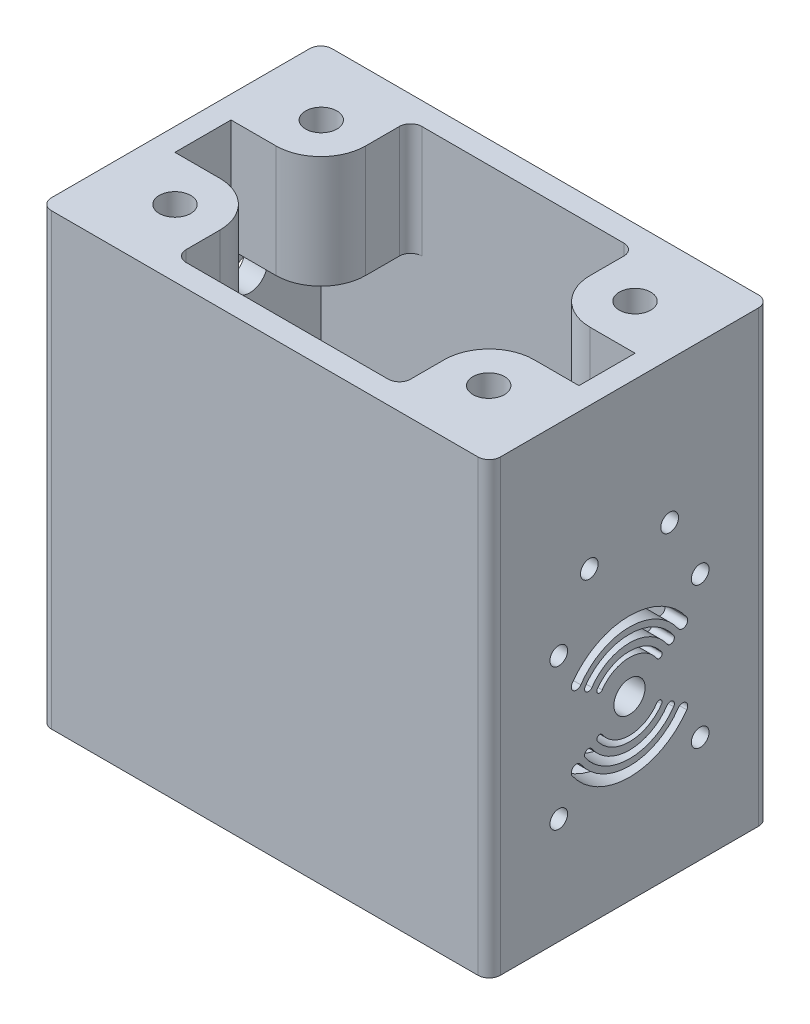
from build123d import *
from OCP.BRepAlgoAPI import BRepAlgoAPI_Cut
from OCP.TopTools import TopTools_ListOfShape

# Parameters (mm, degrees)
CUT_EXTRUDE1_DEPTH         = 101.6
CUT_EXTRUDE1_2_OUTLINE_W   = 25.4
CUT_EXTRUDE1_2_OUTLINE_H   = 20.32
CUT_EXTRUDE1_2_DEPTH       = 27.94
CUT_EXTRUDE1_START         = 73.66
CUT_EXTRUDE1_3_OUTLINE_W   = 25.4
CUT_EXTRUDE1_3_OUTLINE_H   = 20.32
CUT_EXTRUDE1_3_DEPTH       = 27.94
CUT_EXTRUDE1_4_OUTLINE_R   = 1.045
CUT_EXTRUDE1_4_OUTLINE_R_2 = 3.535106702
CUT_EXTRUDE1_4_DEPTH       = 5.08
CUT_EXTRUDE1_START_2       = 96.52
CUT_EXTRUDE1_5_OUTLINE_R   = 1.515
CUT_EXTRUDE1_5_OUTLINE_R_2 = 3.535106702
CUT_EXTRUDE1_5_DEPTH       = 5.08
CUT_EXTRUDE1_START_3       = 86.52
CUT_EXTRUDE1_6_DEPTH       = 10
CUT_EXTRUDE1_START_4       = 76.2
CUT_EXTRUDE1_7_OUTLINE_R   = 2.413
CUT_EXTRUDE1_7_OUTLINE_R_2 = 3.556
CUT_EXTRUDE1_7_DEPTH       = 25.4
CUT_EXTRUDE1_8_OUTLINE_R   = 3.556
CUT_EXTRUDE1_8_DEPTH       = 5.461
CUT_EXTRUDE1_START_5       = -1
CUT_EXTRUDE1_9_DEPTH       = 77.2
CUT_EXTRUDE1_START_6       = 12.4130001
CUT_EXTRUDE1_10_DEPTH      = 2.6669999
CUT_EXTRUDE1_START_7       = 5.280658157
CUT_EXTRUDE1_11_DEPTH      = 2.306341743
CUT_EXTRUDE1_START_8       = 7.5869999
CUT_EXTRUDE1_12_DEPTH      = 4.8260002
CUT_EXTRUDE1_START_9       = 82.1
CUT_EXTRUDE1_13_OUTLINE_R  = 2.413
CUT_EXTRUDE1_13_DEPTH      = 2.95
CUT_EXTRUDE1_14_DEPTH      = 2.6669999
CUT_EXTRUDE1_15_DEPTH      = 2.306341743
CUT_EXTRUDE1_16_DEPTH      = 4.8260002
CUT_EXTRUDE1_START_10      = 78.15
CUT_EXTRUDE1_17_OUTLINE_R  = 2.413
CUT_EXTRUDE1_17_DEPTH      = 2.95
SKETCH2_W                  = 9.799341843
SKETCH2_H                  = 12.300000782
CUT_EXTRUDE2_DEPTH         = 12
SKETCH3_W                  = 10
SKETCH3_H                  = 12.3
CUT_EXTRUDE3_DEPTH         = 12
BOSS_EXTRUDE1_START        = -5.079999
SKETCH6_R                  = 1.515
BOSS_EXTRUDE1_DEPTH        = 5.079999
BOSS_EXTRUDE2_START        = -5.08
SKETCH7_R                  = 1.045
BOSS_EXTRUDE2_DEPTH        = 5.08
SKETCH8_R                  = 2
CUT_EXTRUDE4_DEPTH         = 10
SKETCH9_R                  = 4
CUT_EXTRUDE5_DEPTH         = 10
SKETCH12_R                 = 2
CUT_EXTRUDE6_DEPTH         = 10


with BuildPart() as part:
    # Cut-Extrude1: read off the stored shape, not the designer's step
    # Cut-Extrude1 outline → Cut-Extrude1 (new body)
    with BuildSketch(Plane.YZ):
        Polygon((5.08, 58.42), (101.6, 58.42), (101.6, 63.5), (0, 63.5), (0, 0), (101.6, 0), (101.6, 5.08), (5.08, 5.08), align=None)
    extrude(amount=CUT_EXTRUDE1_DEPTH)


with BuildPart() as cut_extrude1_2_tool:
    # Cut-Extrude1 2 outline → Cut-Extrude1 2 (new body)
    with BuildSketch(Plane.YZ):
        with Locations((88.9, 48.26)):
            Rectangle(CUT_EXTRUDE1_2_OUTLINE_W, CUT_EXTRUDE1_2_OUTLINE_H)
        Polygon((101.6, 5.08), (101.6, 25.400000381), (76.2, 25.4), (76.2, 5.08), align=None)
    extrude(amount=CUT_EXTRUDE1_2_DEPTH)


with BuildPart() as part_1:
    add(part.part)


with BuildPart() as part_2:
    # Cut-Extrude1 2: joined with cut_extrude1_2_tool
    add(part_1.part.fuse(cut_extrude1_2_tool.part, tol=0.00001))


with BuildPart() as cut_extrude1_3_tool:
    # Cut-Extrude1 3 outline → Cut-Extrude1 3 (new body)
    with BuildSketch(Plane.YZ.offset(CUT_EXTRUDE1_START)):
        with Locations((88.9, 48.26)):
            Rectangle(CUT_EXTRUDE1_3_OUTLINE_W, CUT_EXTRUDE1_3_OUTLINE_H)
        Polygon((101.6, 5.08), (101.6, 25.400000381), (76.2, 25.4), (76.2, 5.08), align=None)
    extrude(amount=CUT_EXTRUDE1_3_DEPTH)


with BuildPart() as part_3:
    add(part_2.part)


with BuildPart() as part_4:
    # Cut-Extrude1 3: joined with cut_extrude1_3_tool
    add(part_3.part.fuse(cut_extrude1_3_tool.part, tol=0.00001))


with BuildPart() as cut_extrude1_4_tool:
    # Cut-Extrude1 4 outline → Cut-Extrude1 4 (new body)
    with BuildSketch(Plane.YZ):
        Polygon((76.2, 38.1), (76.2, 58.42), (5.08, 58.42), (5.08, 5.08), (76.2, 5.08), (76.2, 25.400000678), (101.6, 25.4), (101.6, 38.1), align=None)
        with Locations((81.6, 36.100000057)):
            Circle(CUT_EXTRUDE1_4_OUTLINE_R, mode=Mode.SUBTRACT)
        with Locations((81.6, 27.399999275)):
            Circle(CUT_EXTRUDE1_4_OUTLINE_R, mode=Mode.SUBTRACT)
        with BuildLine():
            ThreePointArc((46.057737105, 23.249999873), (50.557737172, 31.75), (46.057737105, 40.250000127))
            ThreePointArc((46.057737105, 40.250000127), (45.78975406, 41.51198884), (47.05773712, 41.750000149))
            ThreePointArc((47.05773712, 41.750000149), (52.258136816, 31.75), (47.05773712, 21.749999851))
            ThreePointArc((47.05773712, 21.749999851), (45.78975406, 21.98801116), (46.057737105, 23.249999873))
        make_face(mode=Mode.SUBTRACT)
        with BuildLine():
            ThreePointArc((49.134013144, 18.789999807), (47.490707098, 19.098462464), (47.838013125, 20.733999836))
            ThreePointArc((47.838013125, 20.733999836), (53.670013212, 31.75), (47.838013125, 42.766000164))
            ThreePointArc((47.838013125, 42.766000164), (47.490707098, 44.401537536), (49.134013144, 44.710000193))
            ThreePointArc((49.134013144, 44.710000193), (55.87373115, 31.75), (49.134013144, 18.789999807))
        make_face(mode=Mode.SUBTRACT)
        with BuildLine():
            ThreePointArc((32.248569061, 20.733999836), (32.595875088, 19.098462464), (30.952569042, 18.789999807))
            ThreePointArc((30.952569042, 18.789999807), (24.212851035, 31.75), (30.952569042, 44.710000193))
            ThreePointArc((30.952569042, 44.710000193), (32.595875088, 44.401537536), (32.248569061, 42.766000164))
            ThreePointArc((32.248569061, 42.766000164), (26.416568974, 31.75), (32.248569061, 20.733999836))
        make_face(mode=Mode.SUBTRACT)
        with BuildLine():
            ThreePointArc((34.028845081, 23.249999873), (34.296828126, 21.98801116), (33.028845066, 21.749999851))
            ThreePointArc((33.028845066, 21.749999851), (27.828445369, 31.75), (33.028845066, 41.750000149))
            ThreePointArc((33.028845066, 41.750000149), (34.296828126, 41.51198884), (34.028845081, 40.250000127))
            ThreePointArc((34.028845081, 40.250000127), (29.528845014, 31.75), (34.028845081, 23.249999873))
        make_face(mode=Mode.SUBTRACT)
        with BuildLine():
            ThreePointArc((35.666722358, 25.570008615), (35.86163475, 24.652125026), (34.939391286, 24.479012008))
            ThreePointArc((34.939391286, 24.479012008), (31.156979061, 31.752322721), (34.939391286, 39.025633433))
            ThreePointArc((34.939391286, 39.025633433), (35.86163475, 38.852520415), (35.666722358, 37.934636826))
            ThreePointArc((35.666722358, 37.934636826), (32.393732537, 31.752322721), (35.666722358, 25.570008615))
        make_face(mode=Mode.SUBTRACT)
        with Locations((40.043291093, 31.75)):
            Circle(CUT_EXTRUDE1_4_OUTLINE_R_2, mode=Mode.SUBTRACT)
        with BuildLine():
            ThreePointArc((44.41570915, 25.570008615), (47.68869897, 31.752322721), (44.41570915, 37.934636826))
            ThreePointArc((44.41570915, 37.934636826), (44.220796757, 38.852520415), (45.143040221, 39.025633433))
            ThreePointArc((45.143040221, 39.025633433), (48.925452447, 31.752322721), (45.143040221, 24.479012008))
            ThreePointArc((45.143040221, 24.479012008), (44.220796757, 24.652125026), (44.41570915, 25.570008615))
        make_face(mode=Mode.SUBTRACT)
    extrude(amount=CUT_EXTRUDE1_4_DEPTH)


with BuildPart() as part_5:
    add(part_4.part)


with BuildPart() as part_6:
    # Cut-Extrude1 4: joined with cut_extrude1_4_tool
    add(part_5.part.fuse(cut_extrude1_4_tool.part, tol=0.00001))


with BuildPart() as cut_extrude1_5_tool:
    # Cut-Extrude1 5 outline → Cut-Extrude1 5 (new body)
    with BuildSketch(Plane.YZ.offset(CUT_EXTRUDE1_START_2)):
        Polygon((76.2, 38.1), (76.2, 58.42), (5.08, 58.42), (5.08, 5.08), (76.2, 5.08), (76.2, 25.400000678), (101.6, 25.4), (101.6, 38.1), align=None)
        with Locations((81.6, 36.100000057)):
            Circle(CUT_EXTRUDE1_5_OUTLINE_R, mode=Mode.SUBTRACT)
        with Locations((81.6, 27.399999275)):
            Circle(CUT_EXTRUDE1_5_OUTLINE_R, mode=Mode.SUBTRACT)
        with BuildLine():
            ThreePointArc((47.05773712, 21.749999851), (45.78975406, 21.98801116), (46.057737105, 23.249999873))
            ThreePointArc((46.057737105, 23.249999873), (50.557737172, 31.75), (46.057737105, 40.250000127))
            ThreePointArc((46.057737105, 40.250000127), (45.78975406, 41.51198884), (47.05773712, 41.750000149))
            ThreePointArc((47.05773712, 41.750000149), (52.258136816, 31.75), (47.05773712, 21.749999851))
        make_face(mode=Mode.SUBTRACT)
        with BuildLine():
            ThreePointArc((49.134013144, 18.789999807), (47.490707098, 19.098462464), (47.838013125, 20.733999836))
            ThreePointArc((47.838013125, 20.733999836), (53.670013212, 31.75), (47.838013125, 42.766000164))
            ThreePointArc((47.838013125, 42.766000164), (47.490707098, 44.401537536), (49.134013144, 44.710000193))
            ThreePointArc((49.134013144, 44.710000193), (55.87373115, 31.75), (49.134013144, 18.789999807))
        make_face(mode=Mode.SUBTRACT)
        with BuildLine():
            ThreePointArc((32.248569061, 20.733999836), (32.595875088, 19.098462464), (30.952569042, 18.789999807))
            ThreePointArc((30.952569042, 18.789999807), (24.212851035, 31.75), (30.952569042, 44.710000193))
            ThreePointArc((30.952569042, 44.710000193), (32.595875088, 44.401537536), (32.248569061, 42.766000164))
            ThreePointArc((32.248569061, 42.766000164), (26.416568974, 31.75), (32.248569061, 20.733999836))
        make_face(mode=Mode.SUBTRACT)
        with BuildLine():
            ThreePointArc((34.028845081, 23.249999873), (34.296828126, 21.98801116), (33.028845066, 21.749999851))
            ThreePointArc((33.028845066, 21.749999851), (27.828445369, 31.75), (33.028845066, 41.750000149))
            ThreePointArc((33.028845066, 41.750000149), (34.296828126, 41.51198884), (34.028845081, 40.250000127))
            ThreePointArc((34.028845081, 40.250000127), (29.528845014, 31.75), (34.028845081, 23.249999873))
        make_face(mode=Mode.SUBTRACT)
        with BuildLine():
            ThreePointArc((35.666722358, 25.570008615), (35.86163475, 24.652125026), (34.939391286, 24.479012008))
            ThreePointArc((34.939391286, 24.479012008), (31.156979061, 31.752322721), (34.939391286, 39.025633433))
            ThreePointArc((34.939391286, 39.025633433), (35.86163475, 38.852520415), (35.666722358, 37.934636826))
            ThreePointArc((35.666722358, 37.934636826), (32.393732537, 31.752322721), (35.666722358, 25.570008615))
        make_face(mode=Mode.SUBTRACT)
        with Locations((40.043291093, 31.75)):
            Circle(CUT_EXTRUDE1_5_OUTLINE_R_2, mode=Mode.SUBTRACT)
        with BuildLine():
            ThreePointArc((44.41570915, 25.570008615), (47.68869897, 31.752322721), (44.41570915, 37.934636826))
            ThreePointArc((44.41570915, 37.934636826), (44.220796757, 38.852520415), (45.143040221, 39.025633433))
            ThreePointArc((45.143040221, 39.025633433), (48.925452447, 31.752322721), (45.143040221, 24.479012008))
            ThreePointArc((45.143040221, 24.479012008), (44.220796757, 24.652125026), (44.41570915, 25.570008615))
        make_face(mode=Mode.SUBTRACT)
    extrude(amount=CUT_EXTRUDE1_5_DEPTH)


with BuildPart() as part_7:
    add(part_6.part)


with BuildPart() as part_8:
    # Cut-Extrude1 5: joined with cut_extrude1_5_tool
    add(part_7.part.fuse(cut_extrude1_5_tool.part, tol=0.00001))


with BuildPart() as cut_extrude1_6_tool:
    # Cut-Extrude1 6 outline → Cut-Extrude1 6 (new body)
    with BuildSketch(Plane.YZ.offset(CUT_EXTRUDE1_START_3)):
        with BuildLine():
            Line((81.1, 37.872395868), (82.1, 37.872395868))
            Line((82.1, 37.872395868), (82.1, 37.530113689))
            ThreePointArc((82.1, 37.530113689), (83.115, 36.100000057), (82.1, 34.669886425))
            Line((82.1, 34.669886425), (82.1, 28.830112907))
            ThreePointArc((82.1, 28.830112907), (83.115, 27.399999275), (82.1, 25.969885643))
            Line((82.1, 25.969885643), (82.1, 25.579376676))
            Line((82.1, 25.579376676), (85.05, 25.579376676))
            Line((85.05, 25.579376676), (85.05, 37.879376676))
            Line((85.05, 37.879376676), (78.15, 37.879376676))
            Line((78.15, 37.879376676), (78.15, 25.579376676))
            Line((78.15, 25.579376676), (81.1, 25.579376676))
            Line((81.1, 25.579376676), (81.1, 25.969885643))
            ThreePointArc((81.1, 25.969885643), (80.085, 27.399999275), (81.1, 28.830112907))
            Line((81.1, 28.830112907), (81.1, 34.669886425))
            ThreePointArc((81.1, 34.669886425), (80.085, 36.100000057), (81.1, 37.530113689))
            Line((81.1, 37.530113689), (81.1, 37.872395868))
        make_face()
    extrude(amount=CUT_EXTRUDE1_6_DEPTH)


with BuildPart() as part_9:
    add(part_8.part)


with BuildPart() as part_10:
    # Cut-Extrude1 6: joined with cut_extrude1_6_tool
    add(part_9.part.fuse(cut_extrude1_6_tool.part, tol=0.00001))


with BuildPart() as cut_extrude1_7_tool:
    # Cut-Extrude1 7 outline → Cut-Extrude1 7 (new body)
    with BuildSketch(Plane(origin=(0, 0, 0), x_dir=(1, 0, 0), z_dir=(0, 1, 0)).offset(CUT_EXTRUDE1_START_4)):
        with Locations((91.44195832, -31.729376676)):
            Circle(CUT_EXTRUDE1_7_OUTLINE_R)
        with Locations((86.300262701, -15.196310633)):
            Circle(CUT_EXTRUDE1_7_OUTLINE_R_2)
        with Locations((15.299737299, -15.196310633)):
            Circle(CUT_EXTRUDE1_7_OUTLINE_R_2)
        with Locations((86.300262701, -48.303689367)):
            Circle(CUT_EXTRUDE1_7_OUTLINE_R_2)
        with Locations((15.299737299, -48.303689367)):
            Circle(CUT_EXTRUDE1_7_OUTLINE_R_2)
        with BuildLine():
            Line((76.2, -55.88), (76.2, -48.26))
            ThreePointArc((76.2, -48.26), (79.175795103, -41.075795103), (86.36, -38.1))
            Line((86.36, -38.1), (73.66, -38.1))
            Line((73.66, -38.1), (73.66, -58.42))
            ThreePointArc((73.66, -58.42), (75.456051224, -57.676051224), (76.2, -55.88))
        make_face()
        with BuildLine():
            ThreePointArc((25.4, -15.24), (22.424204897, -22.424204897), (15.24, -25.4))
            Line((15.24, -25.4), (27.94, -25.400000342))
            Line((27.94, -25.400000342), (27.94, -5.08))
            ThreePointArc((27.94, -5.08), (26.143948776, -5.823948776), (25.4, -7.62))
            Line((25.4, -7.62), (25.4, -15.24))
        make_face()
        with BuildLine():
            Line((76.2, -15.24), (76.2, -7.62))
            ThreePointArc((76.2, -7.62), (75.456051224, -5.823948776), (73.66, -5.08))
            Line((73.66, -5.08), (73.66, -25.400000381))
            Line((73.66, -25.400000381), (86.36, -25.4))
            ThreePointArc((86.36, -25.4), (79.175795103, -22.424204897), (76.2, -15.24))
        make_face()
        with BuildLine():
            Line((101.6, -63.5), (101.6, -60.96))
            ThreePointArc((101.6, -60.96), (100.856051224, -62.756051224), (99.06, -63.5))
            Line((99.06, -63.5), (101.6, -63.5))
        make_face()
        with BuildLine():
            ThreePointArc((99.06, 0), (100.856051224, -0.743948776), (101.6, -2.54))
            Line((101.6, -2.54), (101.6, 0))
            Line((101.6, 0), (99.06, 0))
        make_face()
        with BuildLine():
            Line((0, -63.5), (2.54, -63.5))
            ThreePointArc((2.54, -63.5), (0.743948776, -62.756051224), (0, -60.96))
            Line((0, -60.96), (0, -63.5))
        make_face()
        with BuildLine():
            ThreePointArc((0, -2.54), (0.743948776, -0.743948776), (2.54, 0))
            Line((2.54, 0), (0, 0))
            Line((0, 0), (0, -2.54))
        make_face()
        with BuildLine():
            ThreePointArc((25.4, -55.88), (26.143948776, -57.676051224), (27.94, -58.42))
            Line((27.94, -58.42), (27.94, -38.1))
            Line((27.94, -38.1), (15.24, -38.1))
            ThreePointArc((15.24, -38.1), (22.424204897, -41.075795103), (25.4, -48.26))
            Line((25.4, -48.26), (25.4, -55.88))
        make_face()
    extrude(amount=CUT_EXTRUDE1_7_DEPTH)


with BuildPart() as part_11:
    add(part_10.part)

    # Cut-Extrude1 7: cut by cut_extrude1_7_tool, with a tolerance
    cut_extrude1_7_stock = TopTools_ListOfShape()
    cut_extrude1_7_stock.Append(part_11.part.wrapped)
    cut_extrude1_7_tools = TopTools_ListOfShape()
    cut_extrude1_7_tools.Append(cut_extrude1_7_tool.part.wrapped)
    cut_extrude1_7_cut = BRepAlgoAPI_Cut()
    cut_extrude1_7_cut.SetArguments(cut_extrude1_7_stock)
    cut_extrude1_7_cut.SetTools(cut_extrude1_7_tools)
    cut_extrude1_7_cut.SetFuzzyValue(0.00001)
    cut_extrude1_7_cut.Build()
    add(Compound.cast(cut_extrude1_7_cut.Shape()).solids(), mode=Mode.REPLACE)


with BuildPart() as cut_extrude1_8_tool:
    # Cut-Extrude1 8 outline → Cut-Extrude1 8 (new body)
    # profile 1 of 4: a face of its own
    with BuildSketch(Plane(origin=(0, 0, 0), x_dir=(1, 0, 0), z_dir=(0, 1, 0)).offset(CUT_EXTRUDE1_START_4)):
        Polygon((86.36, -55.963310633), (93.031262701, -52.111655316), (93.031262701, -44.408344684), (86.36, -40.556689367), (79.688737299, -44.408344684), (79.688737299, -52.111655316), align=None)
        with Locations((86.300262701, -48.303689367)):
            Circle(CUT_EXTRUDE1_8_OUTLINE_R, mode=Mode.SUBTRACT)
    # profile 2 of 4: a face of its own
    with BuildSketch(Plane(origin=(0, 0, 0), x_dir=(1, 0, 0), z_dir=(0, 1, 0)).offset(CUT_EXTRUDE1_START_4)):
        Polygon((93.031262701, -19.091655316), (93.031262701, -11.388344684), (86.36, -7.536689367), (79.688737299, -11.388344684), (79.688737299, -19.091655316), (86.36, -22.943310633), align=None)
        with Locations((86.300262701, -15.196310633)):
            Circle(CUT_EXTRUDE1_8_OUTLINE_R, mode=Mode.SUBTRACT)
    # profile 3 of 4: a face of its own
    with BuildSketch(Plane(origin=(0, 0, 0), x_dir=(1, 0, 0), z_dir=(0, 1, 0)).offset(CUT_EXTRUDE1_START_4)):
        Polygon((21.911262701, -52.111655316), (21.911262701, -44.408344684), (15.24, -40.556689367), (8.568737299, -44.408344684), (8.568737299, -52.111655316), (15.24, -55.963310633), align=None)
        with Locations((15.299737299, -48.303689367)):
            Circle(CUT_EXTRUDE1_8_OUTLINE_R, mode=Mode.SUBTRACT)
    # profile 4 of 4: a face of its own
    with BuildSketch(Plane(origin=(0, 0, 0), x_dir=(1, 0, 0), z_dir=(0, 1, 0)).offset(CUT_EXTRUDE1_START_4)):
        Polygon((15.24, -22.943310633), (21.911262701, -19.091655316), (21.911262701, -11.388344684), (15.24, -7.536689367), (8.568737299, -11.388344684), (8.568737299, -19.091655316), align=None)
        with Locations((15.299737299, -15.196310633)):
            Circle(CUT_EXTRUDE1_8_OUTLINE_R, mode=Mode.SUBTRACT)
    extrude(amount=CUT_EXTRUDE1_8_DEPTH)


with BuildPart() as part_12:
    add(part_11.part)

    # Cut-Extrude1 8: cut by cut_extrude1_8_tool, with a tolerance
    cut_extrude1_8_stock = TopTools_ListOfShape()
    cut_extrude1_8_stock.Append(part_12.part.wrapped)
    cut_extrude1_8_tools = TopTools_ListOfShape()
    cut_extrude1_8_tools.Append(cut_extrude1_8_tool.part.wrapped)
    cut_extrude1_8_cut = BRepAlgoAPI_Cut()
    cut_extrude1_8_cut.SetArguments(cut_extrude1_8_stock)
    cut_extrude1_8_cut.SetTools(cut_extrude1_8_tools)
    cut_extrude1_8_cut.SetFuzzyValue(0.00001)
    cut_extrude1_8_cut.Build()
    add(Compound.cast(cut_extrude1_8_cut.Shape()).solids(), mode=Mode.REPLACE)


with BuildPart() as cut_extrude1_9_tool:
    # Cut-Extrude1 9 outline → Cut-Extrude1 9 (new body)
    with BuildSketch(Plane(origin=(0, 0, 0), x_dir=(1, 0, 0), z_dir=(0, 1, 0)).offset(CUT_EXTRUDE1_START_5)):
        with BuildLine():
            Line((101.6, -63.5), (101.6, -60.96))
            ThreePointArc((101.6, -60.96), (100.856051224, -62.756051224), (99.06, -63.5))
            Line((99.06, -63.5), (101.6, -63.5))
        make_face()
        with BuildLine():
            ThreePointArc((99.06, 0), (100.856051224, -0.743948776), (101.6, -2.54))
            Line((101.6, -2.54), (101.6, 0))
            Line((101.6, 0), (99.06, 0))
        make_face()
        with BuildLine():
            Line((0, -63.5), (2.54, -63.5))
            ThreePointArc((2.54, -63.5), (0.743948776, -62.756051224), (0, -60.96))
            Line((0, -60.96), (0, -63.5))
        make_face()
        with BuildLine():
            ThreePointArc((0, -2.54), (0.743948776, -0.743948776), (2.54, 0))
            Line((2.54, 0), (0, 0))
            Line((0, 0), (0, -2.54))
        make_face()
    extrude(amount=CUT_EXTRUDE1_9_DEPTH)


with BuildPart() as part_13:
    add(part_12.part)

    # Cut-Extrude1 9: cut by cut_extrude1_9_tool, with a tolerance
    cut_extrude1_9_stock = TopTools_ListOfShape()
    cut_extrude1_9_stock.Append(part_13.part.wrapped)
    cut_extrude1_9_tools = TopTools_ListOfShape()
    cut_extrude1_9_tools.Append(cut_extrude1_9_tool.part.wrapped)
    cut_extrude1_9_cut = BRepAlgoAPI_Cut()
    cut_extrude1_9_cut.SetArguments(cut_extrude1_9_stock)
    cut_extrude1_9_cut.SetTools(cut_extrude1_9_tools)
    cut_extrude1_9_cut.SetFuzzyValue(0.00001)
    cut_extrude1_9_cut.Build()
    add(Compound.cast(cut_extrude1_9_cut.Shape()).solids(), mode=Mode.REPLACE)

    # Sketch3 → Cut-Extrude3 (cut)
    with BuildSketch(Plane(origin=(0, 85.05, 0), x_dir=(1, 0, 0), z_dir=(0, 1, 0))):
        with Locations((91.52, -31.729376676)):
            Rectangle(SKETCH3_W, SKETCH3_H)
    extrude(amount=-CUT_EXTRUDE3_DEPTH, mode=Mode.SUBTRACT)

    # Sketch6 → Boss-Extrude1 (add)
    with BuildSketch(Plane(origin=(101.6, 0, 0), x_dir=(0, 0, -1), z_dir=(1, 0, 0)).offset(BOSS_EXTRUDE1_START)):
        with Locations((-36.100000057, 81.6)):
            Circle(SKETCH6_R)
        with Locations((-27.399999275, 81.6)):
            Circle(SKETCH6_R)
    extrude(amount=BOSS_EXTRUDE1_DEPTH)

    # Sketch7 → Boss-Extrude2 (add)
    with BuildSketch(Plane.ZY.offset(BOSS_EXTRUDE2_START)):
        with Locations((36.100000057, 81.6)):
            Circle(SKETCH7_R)
        with Locations((27.399999275, 81.6)):
            Circle(SKETCH7_R)
    extrude(amount=BOSS_EXTRUDE2_DEPTH)

    # Sketch8 → Cut-Extrude4 (cut)
    with BuildSketch(Plane(origin=(101.6, 0, 0), x_dir=(0, 0, -1), z_dir=(1, 0, 0))):
        with Locations((-22.66, 69.6)):
            Circle(SKETCH8_R)
        with Locations((-40.84, 69.6)):
            Circle(SKETCH8_R)
    extrude(amount=-CUT_EXTRUDE4_DEPTH, mode=Mode.SUBTRACT)

    # Sketch9 → Cut-Extrude5 (cut)
    with BuildSketch(Plane.ZY):
        with Locations((21.16, 69.6)):
            Circle(SKETCH9_R)
        with Locations((42.34, 69.6)):
            Circle(SKETCH9_R)
    extrude(amount=-CUT_EXTRUDE5_DEPTH, mode=Mode.SUBTRACT)

    # Sketch12 → Cut-Extrude6 (cut)
    with BuildSketch(Plane(origin=(101.6, 0, 0), x_dir=(0, 0, -1), z_dir=(1, 0, 0))):
        with Locations((-47.75, 56.043291093)):
            Circle(SKETCH12_R)
        with Locations((-15.75, 56.043291093)):
            Circle(SKETCH12_R)
        with Locations((-15.75, 24.043291093)):
            Circle(SKETCH12_R)
        with Locations((-47.75, 24.043291093)):
            Circle(SKETCH12_R)
    extrude(amount=-CUT_EXTRUDE6_DEPTH, mode=Mode.SUBTRACT)


with BuildPart() as body_2:
    # Cut-Extrude1 10 outline → Cut-Extrude1 10 (new body)
    with BuildSketch(Plane.YZ.offset(CUT_EXTRUDE1_START_6)):
        with BuildLine():
            Line((82.1, 25.599999275), (85.05, 25.599999275))
            Line((85.05, 25.599999275), (85.05, 37.900000057))
            Line((85.05, 37.900000057), (82.1, 37.900000057))
            Line((82.1, 37.900000057), (82.1, 37.017619259))
            ThreePointArc((82.1, 37.017619259), (82.645, 36.100000057), (82.1, 35.182380855))
            Line((82.1, 35.182380855), (82.1, 28.317618477))
            ThreePointArc((82.1, 28.317618477), (82.645, 27.399999275), (82.1, 26.482380073))
            Line((82.1, 26.482380073), (82.1, 25.599999275))
        make_face()
    extrude(amount=CUT_EXTRUDE1_10_DEPTH)


with BuildPart() as cut_extrude1_11_tool:
    # Cut-Extrude1 11 outline → Cut-Extrude1 11 (new body)
    with BuildSketch(Plane.YZ.offset(CUT_EXTRUDE1_START_7)):
        with BuildLine():
            Line((82.1, 25.599999275), (85.05, 25.599999275))
            Line((85.05, 25.599999275), (85.05, 37.900000057))
            Line((85.05, 37.900000057), (82.1, 37.900000057))
            Line((82.1, 37.900000057), (82.1, 37.017619259))
            ThreePointArc((82.1, 37.017619259), (82.645, 36.100000057), (82.1, 35.182380855))
            Line((82.1, 35.182380855), (82.1, 28.317618477))
            ThreePointArc((82.1, 28.317618477), (82.645, 27.399999275), (82.1, 26.482380073))
            Line((82.1, 26.482380073), (82.1, 25.599999275))
        make_face()
    extrude(amount=CUT_EXTRUDE1_11_DEPTH)


with BuildPart() as body_2_1:
    add(body_2.part)


with BuildPart() as body_2_2:
    # Cut-Extrude1 11: joined with cut_extrude1_11_tool
    add(body_2_1.part.fuse(cut_extrude1_11_tool.part, tol=0.00001))


with BuildPart() as cut_extrude1_12_tool:
    # Cut-Extrude1 12 outline → Cut-Extrude1 12 (new body)
    with BuildSketch(Plane.YZ.offset(CUT_EXTRUDE1_START_8)):
        with BuildLine():
            Line((82.1, 25.599999275), (85.05, 25.599999275))
            Line((85.05, 25.599999275), (85.05, 37.900000057))
            Line((85.05, 37.900000057), (82.1, 37.900000057))
            Line((82.1, 37.900000057), (82.1, 37.017619259))
            ThreePointArc((82.1, 37.017619259), (82.645, 36.100000057), (82.1, 35.182380855))
            Line((82.1, 35.182380855), (82.1, 28.317618477))
            ThreePointArc((82.1, 28.317618477), (82.645, 27.399999275), (82.1, 26.482380073))
            Line((82.1, 26.482380073), (82.1, 25.599999275))
        make_face()
    extrude(amount=CUT_EXTRUDE1_12_DEPTH)


with BuildPart() as body_2_3:
    add(body_2_2.part)


with BuildPart() as body_2_4:
    # Cut-Extrude1 12: joined with cut_extrude1_12_tool
    add(body_2_3.part.fuse(cut_extrude1_12_tool.part, tol=0.00001))


with BuildPart() as cut_extrude1_13_tool:
    # Cut-Extrude1 13 outline → Cut-Extrude1 13 (new body)
    with BuildSketch(Plane(origin=(0, 0, 0), x_dir=(1, 0, 0), z_dir=(0, 1, 0)).offset(CUT_EXTRUDE1_START_9)):
        with Locations((10, -31.75)):
            Circle(CUT_EXTRUDE1_13_OUTLINE_R)
    extrude(amount=CUT_EXTRUDE1_13_DEPTH)


with BuildPart() as body_2_5:
    add(body_2_4.part)

    # Cut-Extrude1 13: cut by cut_extrude1_13_tool, with a tolerance
    cut_extrude1_13_stock = TopTools_ListOfShape()
    cut_extrude1_13_stock.Append(body_2_5.part.wrapped)
    cut_extrude1_13_tools = TopTools_ListOfShape()
    cut_extrude1_13_tools.Append(cut_extrude1_13_tool.part.wrapped)
    cut_extrude1_13_cut = BRepAlgoAPI_Cut()
    cut_extrude1_13_cut.SetArguments(cut_extrude1_13_stock)
    cut_extrude1_13_cut.SetTools(cut_extrude1_13_tools)
    cut_extrude1_13_cut.SetFuzzyValue(0.00001)
    cut_extrude1_13_cut.Build()
    add(Compound.cast(cut_extrude1_13_cut.Shape()).solids(), mode=Mode.REPLACE)


with BuildPart() as body_3:
    # Cut-Extrude1 14 outline → Cut-Extrude1 14 (new body)
    with BuildSketch(Plane.YZ.offset(CUT_EXTRUDE1_START_6)):
        with BuildLine():
            Line((81.1, 28.317618477), (81.1, 35.182380855))
            ThreePointArc((81.1, 35.182380855), (80.555, 36.100000057), (81.1, 37.017619259))
            Line((81.1, 37.017619259), (81.1, 37.900000057))
            Line((81.1, 37.900000057), (78.15, 37.900000057))
            Line((78.15, 37.900000057), (78.15, 25.599999275))
            Line((78.15, 25.599999275), (81.1, 25.599999275))
            Line((81.1, 25.599999275), (81.1, 26.482380073))
            ThreePointArc((81.1, 26.482380073), (80.555, 27.399999275), (81.1, 28.317618477))
        make_face()
    extrude(amount=CUT_EXTRUDE1_14_DEPTH)


with BuildPart() as cut_extrude1_15_tool:
    # Cut-Extrude1 15 outline → Cut-Extrude1 15 (new body)
    with BuildSketch(Plane.YZ.offset(CUT_EXTRUDE1_START_7)):
        with BuildLine():
            Line((81.1, 28.317618477), (81.1, 35.182380855))
            ThreePointArc((81.1, 35.182380855), (80.555, 36.100000057), (81.1, 37.017619259))
            Line((81.1, 37.017619259), (81.1, 37.900000057))
            Line((81.1, 37.900000057), (78.15, 37.900000057))
            Line((78.15, 37.900000057), (78.15, 25.599999275))
            Line((78.15, 25.599999275), (81.1, 25.599999275))
            Line((81.1, 25.599999275), (81.1, 26.482380073))
            ThreePointArc((81.1, 26.482380073), (80.555, 27.399999275), (81.1, 28.317618477))
        make_face()
    extrude(amount=CUT_EXTRUDE1_15_DEPTH)


with BuildPart() as body_3_1:
    add(body_3.part)


with BuildPart() as body_3_2:
    # Cut-Extrude1 15: joined with cut_extrude1_15_tool
    add(body_3_1.part.fuse(cut_extrude1_15_tool.part, tol=0.00001))


with BuildPart() as cut_extrude1_16_tool:
    # Cut-Extrude1 16 outline → Cut-Extrude1 16 (new body)
    with BuildSketch(Plane.YZ.offset(CUT_EXTRUDE1_START_8)):
        with BuildLine():
            Line((81.1, 28.317618477), (81.1, 35.182380855))
            ThreePointArc((81.1, 35.182380855), (80.555, 36.100000057), (81.1, 37.017619259))
            Line((81.1, 37.017619259), (81.1, 37.900000057))
            Line((81.1, 37.900000057), (78.15, 37.900000057))
            Line((78.15, 37.900000057), (78.15, 25.599999275))
            Line((78.15, 25.599999275), (81.1, 25.599999275))
            Line((81.1, 25.599999275), (81.1, 26.482380073))
            ThreePointArc((81.1, 26.482380073), (80.555, 27.399999275), (81.1, 28.317618477))
        make_face()
    extrude(amount=CUT_EXTRUDE1_16_DEPTH)


with BuildPart() as body_3_3:
    add(body_3_2.part)


with BuildPart() as body_3_4:
    # Cut-Extrude1 16: joined with cut_extrude1_16_tool
    add(body_3_3.part.fuse(cut_extrude1_16_tool.part, tol=0.00001))


with BuildPart() as cut_extrude1_17_tool:
    # Cut-Extrude1 17 outline → Cut-Extrude1 17 (new body)
    with BuildSketch(Plane(origin=(0, 0, 0), x_dir=(1, 0, 0), z_dir=(0, 1, 0)).offset(CUT_EXTRUDE1_START_10)):
        with Locations((10, -31.75)):
            Circle(CUT_EXTRUDE1_17_OUTLINE_R)
    extrude(amount=CUT_EXTRUDE1_17_DEPTH)


with BuildPart() as body_3_5:
    add(body_3_4.part)

    # Cut-Extrude1 17: cut by cut_extrude1_17_tool, with a tolerance
    cut_extrude1_17_stock = TopTools_ListOfShape()
    cut_extrude1_17_stock.Append(body_3_5.part.wrapped)
    cut_extrude1_17_tools = TopTools_ListOfShape()
    cut_extrude1_17_tools.Append(cut_extrude1_17_tool.part.wrapped)
    cut_extrude1_17_cut = BRepAlgoAPI_Cut()
    cut_extrude1_17_cut.SetArguments(cut_extrude1_17_stock)
    cut_extrude1_17_cut.SetTools(cut_extrude1_17_tools)
    cut_extrude1_17_cut.SetFuzzyValue(0.00001)
    cut_extrude1_17_cut.Build()
    add(Compound.cast(cut_extrude1_17_cut.Shape()).solids(), mode=Mode.REPLACE)


with BuildPart() as cut_extrude2_tool:
    # Sketch2 → Cut-Extrude2 (new body)
    with BuildSketch(Plane(origin=(0, 85.05, 0), x_dir=(1, 0, 0), z_dir=(0, 1, 0))):
        with Locations((10.180329078, -31.749999666)):
            Rectangle(SKETCH2_W, SKETCH2_H)
    extrude(amount=-CUT_EXTRUDE2_DEPTH)


with BuildPart() as body_2_6:
    add(body_2_5.part)

    # Cut-Extrude2: cut by cut_extrude2_tool
    add(cut_extrude2_tool.part, mode=Mode.SUBTRACT)


with BuildPart() as body_3_6:
    add(body_3_5.part)

    # Cut-Extrude2: cut by cut_extrude2_tool
    add(cut_extrude2_tool.part, mode=Mode.SUBTRACT)


solid = part_13.part
